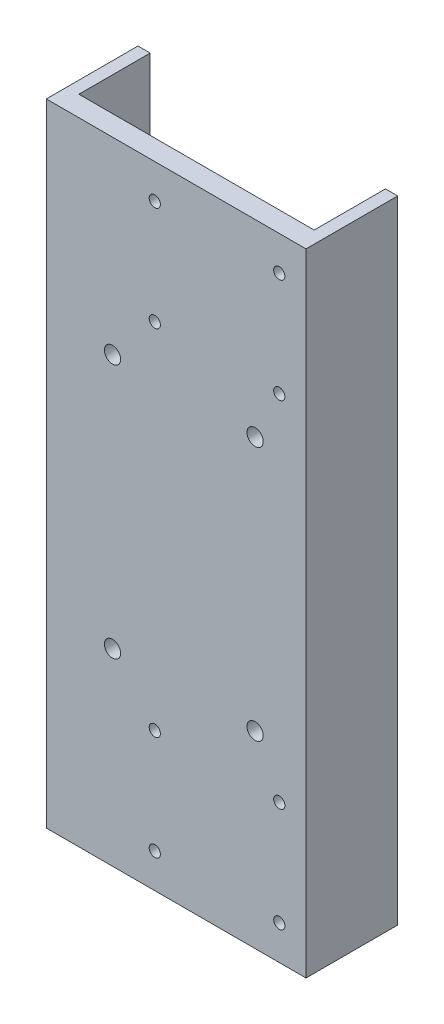
from build123d import *

# Parameters (mm, degrees)
S_BOX1_W      = 51
S_BOX1_H      = 124
BOSS_1_DEPTH  = 4
S_BOX2_W      = 2.4
S_BOX2_H      = 124
BOSS_2_DEPTH  = 14.5
S_BOX3_W      = 2.4
S_BOX3_H      = 124
BOSS_3_DEPTH  = 14.5
S_HOLE4_R     = 11
HOLE_4_DEPTH  = 4.2
S_HOLE5_R     = 1.1
HOLE_5_DEPTH  = 4.2
S_HOLE6_R     = 1.1
HOLE_6_DEPTH  = 4.2
S_HOLE7_R     = 1.1
HOLE_7_DEPTH  = 4.2
S_HOLE8_R     = 1.1
HOLE_8_DEPTH  = 4.2
S_HOLE9_R     = 11
HOLE_9_DEPTH  = 4.2
S_HOLE10_R    = 1.1
HOLE_10_DEPTH = 4.2
S_HOLE11_R    = 1.1
HOLE_11_DEPTH = 4.2
S_HOLE12_R    = 1.1
HOLE_12_DEPTH = 4.2
S_HOLE13_R    = 1.1
HOLE_13_DEPTH = 4.2
S_HOLE14_R    = 1.6
HOLE_14_DEPTH = 4.2
S_HOLE15_R    = 1.6
HOLE_15_DEPTH = 4.2
S_HOLE16_R    = 1.6
HOLE_16_DEPTH = 4.2
S_HOLE17_R    = 1.6
HOLE_17_DEPTH = 4.2


with BuildPart() as part:
    # S_box1 → Boss_1 (new body)
    with BuildSketch(Plane.XY.offset(64.625)):
        with Locations((12.5, 0)):
            Rectangle(S_BOX1_W, S_BOX1_H)
    extrude(amount=BOSS_1_DEPTH)

    # S_box2 → Boss_2 (add)
    with BuildSketch(Plane.XY.offset(50.625)):
        with Locations((-11.8, 0)):
            Rectangle(S_BOX2_W, S_BOX2_H)
    extrude(amount=BOSS_2_DEPTH)

    # S_box3 → Boss_3 (add)
    with BuildSketch(Plane.XY.offset(50.625)):
        with Locations((36.8, 0)):
            Rectangle(S_BOX3_W, S_BOX3_H)
    extrude(amount=BOSS_3_DEPTH)

    # S_hole4 → Hole_4 (cut)
    with BuildSketch(Plane.XY.offset(64.525)):
        with Locations((0, 45)):
            Circle(S_HOLE4_R)
    extrude(amount=-HOLE_4_DEPTH, mode=Mode.SUBTRACT)

    # S_hole5 → Hole_5 (cut)
    with BuildSketch(Plane.XY.offset(64.525)):
        with Locations((8.3, 34.75)):
            Circle(S_HOLE5_R)
    extrude(amount=HOLE_5_DEPTH, mode=Mode.SUBTRACT)

    # S_hole6 → Hole_6 (cut)
    with BuildSketch(Plane.XY.offset(64.525)):
        with Locations((8.3, 55.25)):
            Circle(S_HOLE6_R)
    extrude(amount=HOLE_6_DEPTH, mode=Mode.SUBTRACT)

    # S_hole7 → Hole_7 (cut)
    with BuildSketch(Plane.XY.offset(64.525)):
        with Locations((32.75, 34.75)):
            Circle(S_HOLE7_R)
    extrude(amount=HOLE_7_DEPTH, mode=Mode.SUBTRACT)

    # S_hole8 → Hole_8 (cut)
    with BuildSketch(Plane.XY.offset(64.525)):
        with Locations((32.75, 55.25)):
            Circle(S_HOLE8_R)
    extrude(amount=HOLE_8_DEPTH, mode=Mode.SUBTRACT)

    # S_hole9 → Hole_9 (cut)
    with BuildSketch(Plane.XY.offset(64.525)):
        with Locations((0, -45)):
            Circle(S_HOLE9_R)
    extrude(amount=-HOLE_9_DEPTH, mode=Mode.SUBTRACT)

    # S_hole10 → Hole_10 (cut)
    with BuildSketch(Plane.XY.offset(64.525)):
        with Locations((8.3, -55.25)):
            Circle(S_HOLE10_R)
    extrude(amount=HOLE_10_DEPTH, mode=Mode.SUBTRACT)

    # S_hole11 → Hole_11 (cut)
    with BuildSketch(Plane.XY.offset(64.525)):
        with Locations((8.3, -34.75)):
            Circle(S_HOLE11_R)
    extrude(amount=HOLE_11_DEPTH, mode=Mode.SUBTRACT)

    # S_hole12 → Hole_12 (cut)
    with BuildSketch(Plane.XY.offset(64.525)):
        with Locations((32.75, -55.25)):
            Circle(S_HOLE12_R)
    extrude(amount=HOLE_12_DEPTH, mode=Mode.SUBTRACT)

    # S_hole13 → Hole_13 (cut)
    with BuildSketch(Plane.XY.offset(64.525)):
        with Locations((32.75, -34.75)):
            Circle(S_HOLE13_R)
    extrude(amount=HOLE_13_DEPTH, mode=Mode.SUBTRACT)

    # S_hole14 → Hole_14 (cut)
    with BuildSketch(Plane.XY.offset(64.525)):
        with Locations((0, -25)):
            Circle(S_HOLE14_R)
    extrude(amount=HOLE_14_DEPTH, mode=Mode.SUBTRACT)

    # S_hole15 → Hole_15 (cut)
    with BuildSketch(Plane.XY.offset(64.525)):
        with Locations((0, 25)):
            Circle(S_HOLE15_R)
    extrude(amount=HOLE_15_DEPTH, mode=Mode.SUBTRACT)

    # S_hole16 → Hole_16 (cut)
    with BuildSketch(Plane.XY.offset(64.525)):
        with Locations((28, -25)):
            Circle(S_HOLE16_R)
    extrude(amount=HOLE_16_DEPTH, mode=Mode.SUBTRACT)

    # S_hole17 → Hole_17 (cut)
    with BuildSketch(Plane.XY.offset(64.525)):
        with Locations((28, 25)):
            Circle(S_HOLE17_R)
    extrude(amount=HOLE_17_DEPTH, mode=Mode.SUBTRACT)


solid = part.part
